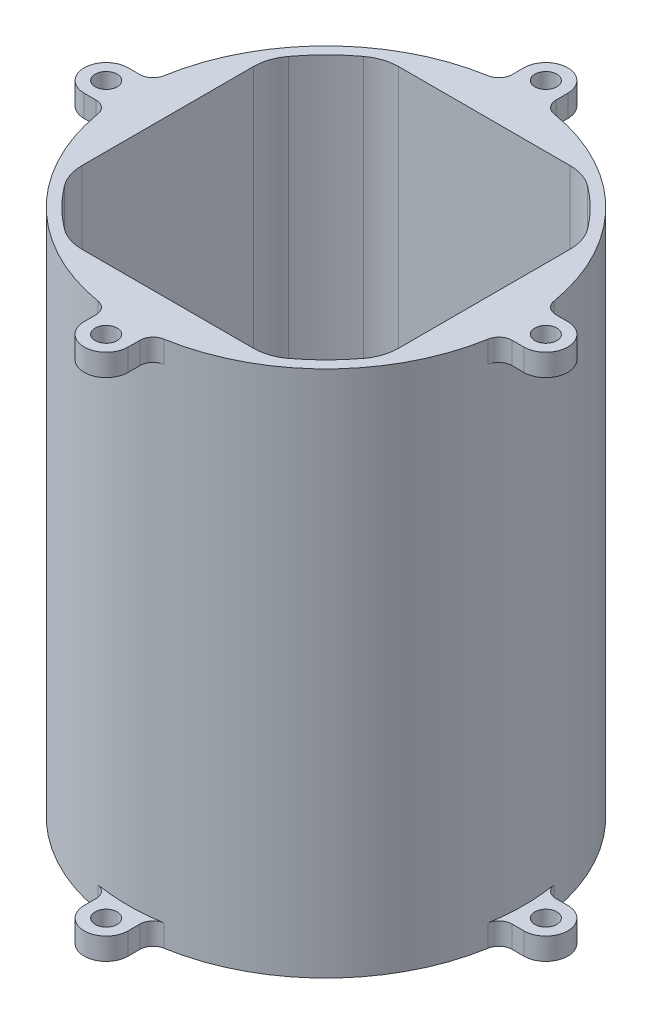
from build123d import *

# Parameters (mm, degrees)
SKETCH1_R                = 45
SKETCH1_R_2              = 42.5
BOSS_EXTRUDE1_DEPTH      = 120
SKETCH2_R                = 2.5
BOSS_EXTRUDE2_DEPTH      = 5
FILLET2_R                = 3
CIRPATTERN1_COUNT        = 4
FILLET2_OF_CIRPATTERN1_R = 3
MIRROR1_START            = 115
MIRROR1_OUTLINE_R        = 2.5
MIRROR1_DEPTH            = 5
SKETCH1_2_R              = 42.5
BOSS_EXTRUDE4_DEPTH      = 15
SKETCH7_R                = 2
CUT_EXTRUDE1_DEPTH       = 144.003496461
SKETCH10_R               = 20
CUT_EXTRUDE5_DEPTH       = 10
BOSS_EXTRUDE3_DEPTH      = 120
CIRPATTERN2_COUNT        = 4
FILLET1_R                = 10


# Read off the part's stored shape, not the designer's step: Mirror1
with BuildPart() as part:
    # Sketch1 → Boss-Extrude1 (new body)
    with BuildSketch(Plane(origin=(0, 0, 0), x_dir=(1, 0, 0), z_dir=(0, 1, 0))):
        with Locations(Location((0, 0, 0), (0, 0, 270))):
            Circle(SKETCH1_R)
        with Locations(Location((0, 0, 0), (0, 0, 270))):
            Circle(SKETCH1_R_2, mode=Mode.SUBTRACT)
    extrude(amount=BOSS_EXTRUDE1_DEPTH)

    # Sketch2 → Boss-Extrude2 (add)
    with BuildSketch(Plane(origin=(0, 0, 0), x_dir=(1, 0, 0), z_dir=(0, 1, 0))):
        with BuildLine():
            Line((-5, -44.72135955), (-5, -50))
            ThreePointArc((-5, -50), (0, -55), (5, -50))
            Line((5, -50), (5, -44.72135955))
            ThreePointArc((5, -44.72135955), (0, -45), (-5, -44.72135955))
        make_face()
        with Locations(Location((0, -50, 0), (0, 0, 270))):
            Circle(SKETCH2_R, mode=Mode.SUBTRACT)
    boss_extrude2 = extrude(amount=BOSS_EXTRUDE2_DEPTH)

    # Fillet2
    fillet2_edges = [part.edges().sort_by_distance(p)[0] for p in [
        (5, 2.5, 44.72135955),
        (-5, 2.5, 44.72135955),
    ]]
    fillet(fillet2_edges, radius=FILLET2_R)

    # CirPattern1: Boss-Extrude2 ×4 about axis
    cirpattern1_axis = Axis((0, 0, 0), (0, 1, 0))
    for i in range(1, CIRPATTERN1_COUNT):
        add(boss_extrude2.rotate(cirpattern1_axis, i * 360 / CIRPATTERN1_COUNT))

    # Fillet2 of CirPattern1
    fillet2_of_cirpattern1_edges = [part.edges().sort_by_distance(p)[0] for p in [
        (44.72135955, 2.5, -5),
        (44.72135955, 2.5, 5),
        (-5, 2.5, -44.72135955),
        (5, 2.5, -44.72135955),
        (-44.72135955, 2.5, 5),
        (-44.72135955, 2.5, -5),
    ]]
    fillet(fillet2_of_cirpattern1_edges, radius=FILLET2_OF_CIRPATTERN1_R)

    # Mirror1 outline → Mirror1 (add)
    # profile 1 of 4: a face of its own
    with BuildSketch(Plane(origin=(0, 0, 0), x_dir=(1, 0, 0), z_dir=(0, 1, 0)).offset(MIRROR1_START)):
        with BuildLine():
            ThreePointArc((-7.5, -44.370598373), (-5.708712153, -45.392146592), (-5, -47.328638265))
            Line((-5, -47.328638265), (-5, -50))
            ThreePointArc((-5, -50), (0, -55), (5, -50))
            Line((5, -50), (5, -47.328638265))
            ThreePointArc((5, -47.328638265), (5.708712153, -45.392146592), (7.5, -44.370598373))
            ThreePointArc((7.5, -44.370598373), (0, -45), (-7.5, -44.370598373))
        make_face()
        with Locations((0, -50)):
            Circle(MIRROR1_OUTLINE_R, mode=Mode.SUBTRACT)
    # profile 2 of 4: a face of its own
    with BuildSketch(Plane(origin=(0, 0, 0), x_dir=(1, 0, 0), z_dir=(0, 1, 0)).offset(MIRROR1_START)):
        with BuildLine():
            ThreePointArc((-47.328638265, -5), (-45.392146592, -5.708712153), (-44.370598373, -7.5))
            ThreePointArc((-44.370598373, -7.5), (-45, 0), (-44.370598373, 7.5))
            ThreePointArc((-44.370598373, 7.5), (-45.392146592, 5.708712153), (-47.328638265, 5))
            Line((-47.328638265, 5), (-50, 5))
            ThreePointArc((-50, 5), (-55, 0), (-50, -5))
            Line((-50, -5), (-47.328638265, -5))
        make_face()
        with Locations((-50, 0)):
            Circle(MIRROR1_OUTLINE_R, mode=Mode.SUBTRACT)
    # profile 3 of 4: a face of its own
    with BuildSketch(Plane(origin=(0, 0, 0), x_dir=(1, 0, 0), z_dir=(0, 1, 0)).offset(MIRROR1_START)):
        with BuildLine():
            ThreePointArc((44.370598373, 7.5), (45, 0), (44.370598373, -7.5))
            ThreePointArc((44.370598373, -7.5), (45.392146592, -5.708712153), (47.328638265, -5))
            Line((47.328638265, -5), (50, -5))
            ThreePointArc((50, -5), (55, 0), (50, 5))
            Line((50, 5), (47.328638265, 5))
            ThreePointArc((47.328638265, 5), (45.392146592, 5.708712153), (44.370598373, 7.5))
        make_face()
        with Locations((50, 0)):
            Circle(MIRROR1_OUTLINE_R, mode=Mode.SUBTRACT)
    # profile 4 of 4: a face of its own
    with BuildSketch(Plane(origin=(0, 0, 0), x_dir=(1, 0, 0), z_dir=(0, 1, 0)).offset(MIRROR1_START)):
        with BuildLine():
            ThreePointArc((-5, 47.328638265), (-5.708712153, 45.392146592), (-7.5, 44.370598373))
            ThreePointArc((-7.5, 44.370598373), (0, 45), (7.5, 44.370598373))
            ThreePointArc((7.5, 44.370598373), (5.708712153, 45.392146592), (5, 47.328638265))
            Line((5, 47.328638265), (5, 50))
            ThreePointArc((5, 50), (0, 55), (-5, 50))
            Line((-5, 50), (-5, 47.328638265))
        make_face()
        with Locations((0, 50)):
            Circle(MIRROR1_OUTLINE_R, mode=Mode.SUBTRACT)
    extrude(amount=MIRROR1_DEPTH)

    # Sketch1<2> → Boss-Extrude4 (add)
    with BuildSketch(Plane(origin=(0, 0, 0), x_dir=(1, 0, 0), z_dir=(0, 1, 0))):
        with Locations(Location((0, 0, 0), (0, 0, 270))):
            Circle(SKETCH1_2_R)
    extrude(amount=BOSS_EXTRUDE4_DEPTH)

    # Sketch7 → Cut-Extrude1 (cut, through all)
    with BuildSketch(Plane.XZ):
        with Locations(Location((0, 0, 0), (0, 0, 270))):
            Circle(SKETCH7_R)
    extrude(amount=-CUT_EXTRUDE1_DEPTH, mode=Mode.SUBTRACT)

    # Sketch10 → Cut-Extrude5 (cut)
    with BuildSketch(Plane.XZ):
        with Locations(Location((0, 0, 0), (0, 0, 270))):
            Circle(SKETCH10_R)
    extrude(amount=-CUT_EXTRUDE5_DEPTH, mode=Mode.SUBTRACT)

    # Sketch6 → Boss-Extrude3 (add)
    with BuildSketch(Plane.XZ):
        with BuildLine():
            Line((-22.588713996, -36), (22.588713996, -36))
            ThreePointArc((22.588713996, -36), (0, -42.5), (-22.588713996, -36))
        make_face()
    boss_extrude3 = extrude(amount=-BOSS_EXTRUDE3_DEPTH)

    # CirPattern2: Boss-Extrude3 ×4 about axis
    cirpattern2_axis = Axis((0, 0, 0), (0, 1, 0))
    for i in range(1, CIRPATTERN2_COUNT):
        add(boss_extrude3.rotate(cirpattern2_axis, i * 360 / CIRPATTERN2_COUNT))

    # Fillet1
    fillet1_edges = [part.edges().sort_by_distance(p)[0] for p in [
        (-22.588713996, 67.5, -36),
        (22.588713996, 67.5, -36),
        (-36, 67.5, 22.588713996),
        (-36, 67.5, -22.588713996),
        (22.588713996, 67.5, 36),
        (-22.588713996, 67.5, 36),
        (36, 67.5, -22.588713996),
        (36, 67.5, 22.588713996),
    ]]
    fillet(fillet1_edges, radius=FILLET1_R)


solid = part.part
